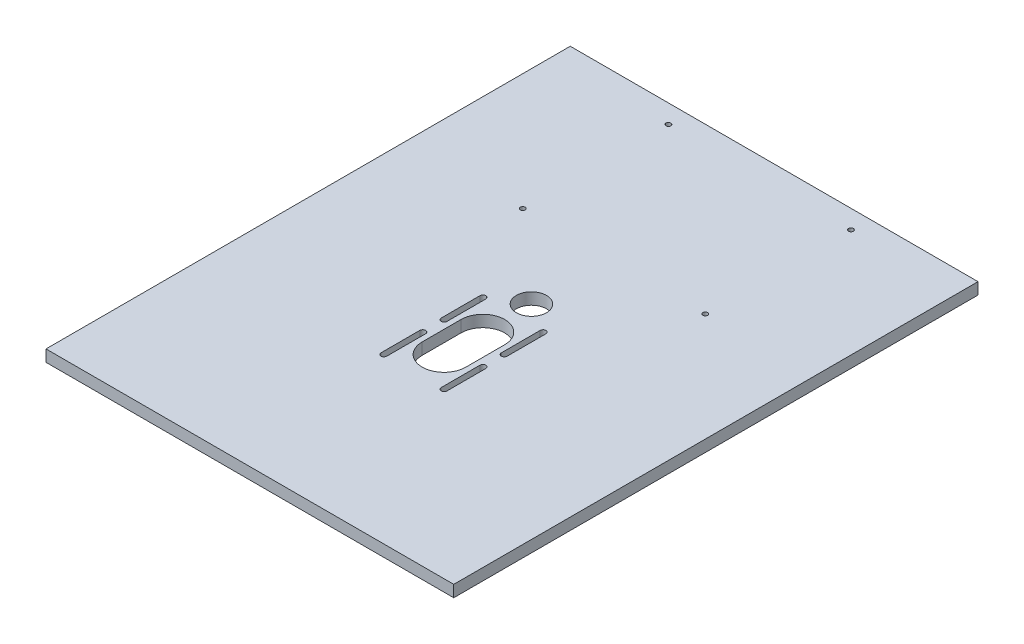
from build123d import *

# Parameters (mm, degrees)
SKETCH1_W           = 210
SKETCH1_H           = 270
SKETCH1_R           = 7.75
BOSS_EXTRUDE2_DEPTH = 6
CUT_EXTRUDE1_DEPTH  = 10
SKETCH4_R           = 1.25
CUT_EXTRUDE2_DEPTH  = 10


with BuildPart() as part:
    # Sketch1 → Boss-Extrude2 (new body)
    with BuildSketch(Plane(origin=(0, 0, 0), x_dir=(1, 0, 0), z_dir=(0, 1, 0))):
        with Locations((0, -10)):
            Rectangle(SKETCH1_W, SKETCH1_H)
        Circle(SKETCH1_R, mode=Mode.SUBTRACT)
    extrude(amount=BOSS_EXTRUDE2_DEPTH)

    # Sketch3 → Cut-Extrude1 (cut)
    with BuildSketch(Plane.XZ):
        with BuildLine():
            Line((17.000022153, 29.5), (17.000022153, 9.5))
            ThreePointArc((17.000022153, 9.5), (15.500022153, 8), (14.000022153, 9.5))
            Line((14.000022153, 9.5), (14.000022153, 29.5))
            ThreePointArc((14.000022153, 29.5), (15.500022153, 31), (17.000022153, 29.5))
        make_face()
        with BuildLine():
            Line((17.000022153, 60.5), (17.000022153, 40.5))
            ThreePointArc((17.000022153, 40.5), (15.500022153, 39), (14.000022153, 40.5))
            Line((14.000022153, 40.5), (14.000022153, 60.5))
            ThreePointArc((14.000022153, 60.5), (15.500022153, 62), (17.000022153, 60.5))
        make_face()
        with BuildLine():
            Line((-16.999993108, 29.500016738), (-17.0000128, 9.500016738))
            ThreePointArc((-17.0000128, 9.500016738), (-15.500014277, 8.000015261), (-14.0000128, 9.500013784))
            Line((-14.0000128, 9.500013784), (-13.999993108, 29.500013784))
            ThreePointArc((-13.999993108, 29.500013784), (-15.499991631, 31.000015261), (-16.999993108, 29.500016738))
        make_face()
        with BuildLine():
            Line((-16.999962586, 60.500016738), (-16.999982277, 40.500016738))
            ThreePointArc((-16.999982277, 40.500016738), (-15.499983754, 39.000015261), (-13.999982277, 40.500013784))
            Line((-13.999982277, 40.500013784), (-13.999962586, 60.500013784))
            ThreePointArc((-13.999962586, 60.500013784), (-15.499961109, 62.000015261), (-16.999962586, 60.500016738))
        make_face()
        with BuildLine():
            Line((11.250022153, 44.999994462), (11.250012307, 24.999994462))
            ThreePointArc((11.250012307, 24.999994462), (6.769e-06, 13.75), (-11.249987693, 25.000005538))
            Line((-11.249987693, 25.000005538), (-11.249977847, 45.000005538))
            ThreePointArc((-11.249977847, 45.000005538), (2.7692e-05, 56.25), (11.250022153, 44.999994462))
        make_face()
    extrude(amount=-CUT_EXTRUDE1_DEPTH, mode=Mode.SUBTRACT)

    # Sketch4 → Cut-Extrude2 (cut)
    with BuildSketch(Plane.XZ):
        with Locations((49.170333674, -115.382230576)):
            Circle(SKETCH4_R)
        with Locations((-44.829666326, -115.382230576)):
            Circle(SKETCH4_R)
        with Locations((49.170333674, -40.382230576)):
            Circle(SKETCH4_R)
        with Locations((-44.829666326, -40.382230576)):
            Circle(SKETCH4_R)
    extrude(amount=-CUT_EXTRUDE2_DEPTH, mode=Mode.SUBTRACT)


solid = part.part
